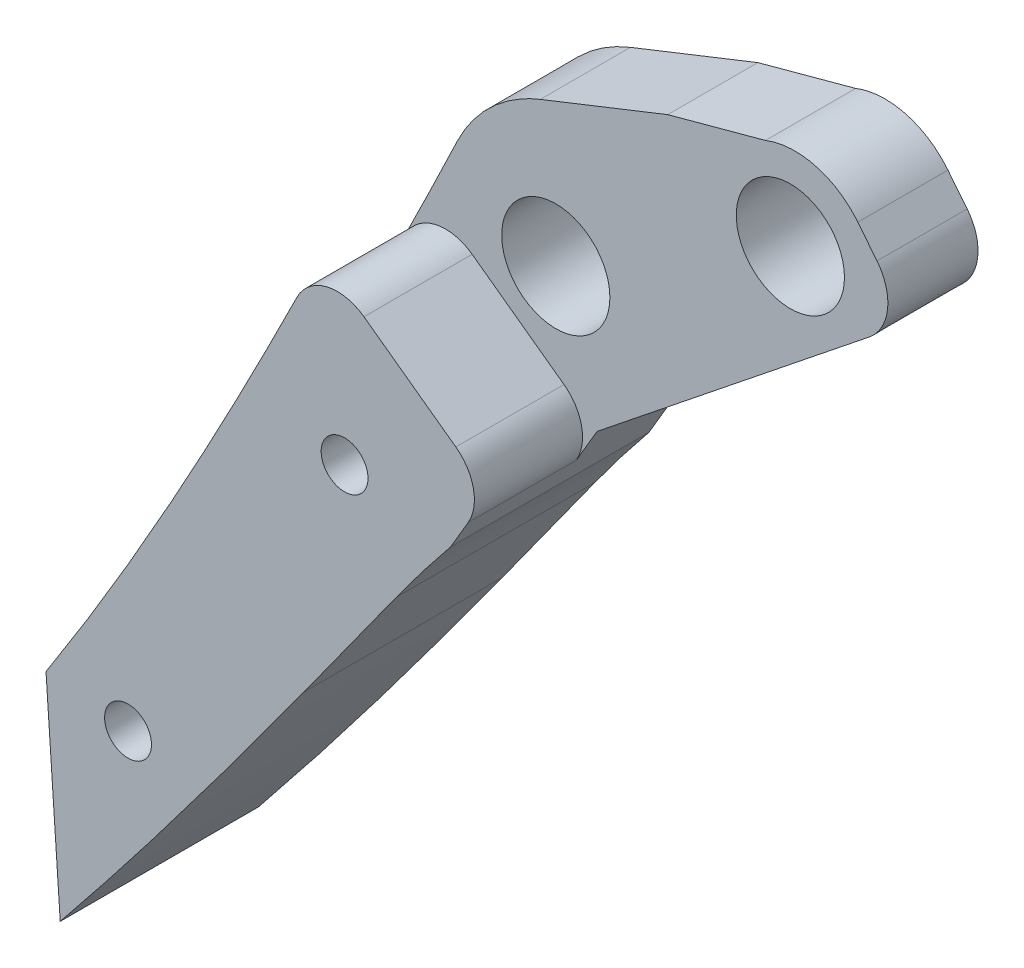
from build123d import *

# Parameters (mm, degrees)
SKETCH_1_R              = 6
SKETCH_1_R_2            = 2.6
EXTRUDE_1_DEPTH         = 22
CUT_EXTRUDE_START       = -12
CUT_EXTRUDE_1_OUTLINE_R = 6
CUT_EXTRUDE_1_DEPTH     = 12
FILLET_1_R              = 5


# Read off the part's stored shape, not the designer's step: 切除-拉伸1
with BuildPart() as part:
    # 草图1 → 凸台-拉伸1 (new body)
    with BuildSketch(Plane.XY):
        with BuildLine():
            Line((24.04705584, 21.941390991), (25.62631028, -1.269568576))
            add(Edge.make_bspline(
                [(25.62631028, -1.269568576), (30.294741582, 4.490329629), (34.848985416, 10.341994574), (43.840833171, 22.214968329), (48.277316557, 28.236694952), (52.668077763, 34.291262241)],
                knots=[0.751086715, 0.751086715, 0.751086715, 0.751086715, 0.875, 0.875, 1, 1, 1, 1], degree=3))
            add(Edge.make_bspline(
                [(52.668077763, 34.291262241), (54.385569076, 36.659627804), (56.095877797, 39.033185186), (58.65356822, 42.599078019), (59.503877121, 43.78931812), (61.206685795, 46.168192958), (62.060572053, 47.355980663), (62.923151952, 48.537325445)],
                knots=[0, 0, 0, 0, 12.867122322, 12.867122322, 19.300683483, 19.300683483, 25.734244644, 25.734244644, 25.734244644, 25.734244644], degree=3))
            add(Edge.make_bspline(
                [(62.923151952, 48.537325445), (63.691030086, 49.593267388), (64.385737457, 50.528608987), (65.152866174, 51.561457391), (65.870104463, 52.500349083), (66.644032214, 53.513449395), (67.382538536, 54.446906012), (68.169071386, 55.441067159), (68.929366855, 56.362602713)],
                knots=[0, 0, 0, 0.25, 0.25, 0.5, 0.5, 0.75, 0.75, 1, 1, 1], degree=2))
            add(Edge.make_bspline(
                [(68.929366855, 56.362602713), (68.939807825, 56.376913703), (68.94904286, 56.392240586)],
                knots=[0.088106579, 0.088106579, 0.088106579, 0.143786066, 0.143786066, 0.143786066], degree=2, weights=[1, 0.999612499, 1]))
            Line((68.94904286, 56.392240586), (73.182530774, 63.58271012))
            Line((73.182530774, 63.58271012), (77.6764923, 67.17962487))
            ThreePointArc((77.6764923, 67.17962487), (78.379967095, 67.75128437), (79.091839453, 68.312452009))
            Line((79.091839453, 68.312452009), (103.36876376, 87.743421018))
            add(Edge.make_bspline(
                [(103.36876376, 87.743421018), (103.794913212, 88.083498112), (104.14591982, 88.500209303), (104.495810247, 88.915595377), (104.757584433, 89.390611784), (105.019785316, 89.866402479), (105.18387744, 90.383514181), (105.347603834, 90.89947334), (105.407790685, 91.436682712), (105.468371762, 91.977410832), (105.422168005, 92.518813243), (105.376170251, 93.057801763), (105.226513558, 93.576866403), (105.075866476, 94.099366077), (104.826403144, 94.581721125), (104.577389608, 95.06320646), (104.239613139, 95.486702432)],
                knots=[0, 0, 0, 0.125, 0.125, 0.25, 0.25, 0.375, 0.375, 0.5, 0.5, 0.625, 0.625, 0.75, 0.75, 0.875, 0.875, 1, 1, 1], degree=2))
            Line((104.239613139, 95.486702432), (102.10787197, 98.150082549))
            add(Edge.make_bspline(
                [(102.10787197, 98.150082549), (101.662660323, 98.707408746), (101.134816221, 99.186660834), (100.605787322, 99.666988651), (100.007698858, 100.056631193), (99.413800036, 100.443544268), (98.766951597, 100.73157288), (98.115443256, 101.021676452), (97.426848492, 101.204456829), (96.741213417, 101.386451586), (96.036172435, 101.457788474), (95.327397899, 101.529503128), (94.616958411, 101.487928839), (93.907956416, 101.446438671), (93.215156177, 101.29350915), (92.520746602, 101.140224382), (91.859708878, 100.879055504)],
                knots=[0, 0, 0, 0.125, 0.125, 0.25, 0.25, 0.375, 0.375, 0.5, 0.5, 0.625, 0.625, 0.75, 0.75, 0.875, 0.875, 1, 1, 1], degree=2))
            Line((91.859708878, 100.879055504), (81.022663549, 97.937140274))
            Line((81.022663549, 97.937140274), (66.880013026, 92.33227511))
            add(Edge.make_bspline(
                [(66.880013026, 92.33227511), (65.373977149, 91.735592871), (64.00578846, 90.868278931), (62.646323986, 90.006495393), (61.470305816, 88.907497765), (60.292351586, 87.806690876), (59.339427675, 86.506195587), (58.383073515, 85.201018894), (57.686838347, 83.740417625)],
                knots=[0, 0, 0, 0.25, 0.25, 0.5, 0.5, 0.75, 0.75, 1, 1, 1], degree=2))
            add(Edge.make_bspline(
                [(57.686838347, 83.740417625), (56.095548431, 80.401632953), (54.518583687, 77.162280014)],
                knots=[0, 0, 0, 1, 1, 1], degree=2))
            add(Edge.make_bspline(
                [(54.518583687, 77.162280014), (53.763269837, 75.610969128), (52.999745837, 74.063699923), (51.467519232, 70.971710828), (50.697291265, 69.427763476), (49.146563784, 66.345016376), (48.366275895, 64.806128726), (46.794629467, 61.734063391), (46.003946156, 60.200522916), (45.205011248, 58.67121375)],
                knots=[0, 0, 0, 0, 0.25, 0.25, 0.5, 0.5, 0.75, 0.75, 1, 1, 1, 1], degree=3))
            add(Edge.make_bspline(
                [(45.205011248, 58.67121375), (41.847412181, 52.245521434), (38.381271035, 45.876195204), (31.340232317, 33.621328767), (27.77883413, 27.726649653), (24.04705584, 21.941390991)],
                knots=[0, 0, 0, 0, 0.125, 0.125, 0.243696274, 0.243696274, 0.243696274, 0.243696274], degree=3))
        make_face()
        with Locations((94.625559773, 92.089088396)):
            Circle(SKETCH_1_R, mode=Mode.SUBTRACT)
        with Locations((68.602677697, 77.162280014)):
            Circle(SKETCH_1_R, mode=Mode.SUBTRACT)
        with Locations((33.14705584, 20.777472123)):
            Circle(SKETCH_1_R_2, mode=Mode.SUBTRACT)
        with Locations((57.169835175, 58.366266824)):
            Circle(SKETCH_1_R_2, mode=Mode.SUBTRACT)
    extrude(amount=EXTRUDE_1_DEPTH)

    # 切除-拉伸1 outline → 切除-拉伸1 (cut)
    with BuildSketch(Plane.XY.offset(22).offset(CUT_EXTRUDE_START)):
        with BuildLine():
            add(Edge.make_bspline(
                [(57.686838346, 83.740417623), (56.09554843, 80.401632953), (54.518583688, 77.162280014)],
                knots=[0.494428836, 0.494428836, 0.494428836, 0.494587311, 0.494587311, 0.494587311], degree=2))
            Line((54.518583688, 77.162280014), (73.182530774, 63.58271012))
            Line((73.182530774, 63.58271012), (77.6764923, 67.17962487))
            ThreePointArc((77.6764923, 67.17962487), (78.379967095, 67.75128437), (79.091839453, 68.312452009))
            Line((79.091839453, 68.312452009), (103.36876376, 87.743421018))
            add(Edge.make_bspline(
                [(103.36876376, 87.743421018), (103.794913212, 88.083498112), (104.14591982, 88.500209303), (104.495810247, 88.915595377), (104.757584433, 89.390611784), (105.019785316, 89.866402479), (105.18387744, 90.383514181), (105.347603834, 90.89947334), (105.407790685, 91.436682712), (105.468371762, 91.977410832), (105.422168005, 92.518813243), (105.376170251, 93.057801763), (105.226513558, 93.576866403), (105.075866476, 94.099366077), (104.826403144, 94.581721125), (104.577389608, 95.06320646), (104.239613139, 95.486702432)],
                knots=[0, 0, 0, 0.125, 0.125, 0.25, 0.25, 0.375, 0.375, 0.5, 0.5, 0.625, 0.625, 0.75, 0.75, 0.875, 0.875, 1, 1, 1], degree=2))
            Line((104.239613139, 95.486702432), (102.10787197, 98.150082549))
            add(Edge.make_bspline(
                [(102.10787197, 98.150082549), (101.662660323, 98.707408746), (101.134816221, 99.186660834), (100.605787322, 99.666988651), (100.007698858, 100.056631193), (99.413800036, 100.443544268), (98.766951597, 100.73157288), (98.115443256, 101.021676452), (97.426848492, 101.204456829), (96.741213417, 101.386451586), (96.036172435, 101.457788474), (95.327397899, 101.529503128), (94.616958411, 101.487928839), (93.907956416, 101.446438671), (93.215156177, 101.29350915), (92.520746602, 101.140224382), (91.859708878, 100.879055504)],
                knots=[0, 0, 0, 0.125, 0.125, 0.25, 0.25, 0.375, 0.375, 0.5, 0.5, 0.625, 0.625, 0.75, 0.75, 0.875, 0.875, 1, 1, 1], degree=2))
            Line((91.859708878, 100.879055504), (81.022663549, 97.937140274))
            Line((81.022663549, 97.937140274), (66.880013026, 92.33227511))
            add(Edge.make_bspline(
                [(66.880013026, 92.33227511), (65.373977149, 91.735592871), (64.00578846, 90.868278931), (62.646323986, 90.006495393), (61.470305816, 88.907497765), (60.292351586, 87.806690876), (59.339427675, 86.506195587), (58.383073515, 85.201018894), (57.686838346, 83.740417623)],
                knots=[0, 0, 0, 0.25, 0.25, 0.5, 0.5, 0.75, 0.75, 1, 1, 1], degree=2))
        make_face()
        with Locations((68.602677697, 77.162280014)):
            Circle(CUT_EXTRUDE_1_OUTLINE_R, mode=Mode.SUBTRACT)
        with Locations((94.625559773, 92.089088396)):
            Circle(CUT_EXTRUDE_1_OUTLINE_R, mode=Mode.SUBTRACT)
    extrude(amount=CUT_EXTRUDE_1_DEPTH, mode=Mode.SUBTRACT)

    # 圆角1
    fillet_1_edges = [part.edges().sort_by_distance(p)[0] for p in [
        (73.182530774, 63.58271012, 16),
    ]]
    fillet(fillet_1_edges, radius=FILLET_1_R)
    # the kernel refuses this fillet: 5 mm, written as the material it takes off along each edge
    with BuildSketch(Plane(origin=(54.518583687, 77.162280014, 10), x_dir=(0.8086167393984858, -0.5883357619289866, 0), z_dir=(0, 0, 1))) as fillet_1_2_piece_1:
        with BuildLine():
            CenterArc((5.939761688, -5), FILLET_1_R, 89.999999998, 99.633547548)
            Line((1.010270575, -5.836730169), (0.911680753, -5.853464772))
            ThreePointArc((0.911680753, -5.853464772), (0.412045155, -2.934442011), (-0.098457006, -0.017499087))
            Line((-0.098457006, -0.017499087), (0, 0.1))
            Line((0, 0.1), (5.939761688, 0.1))
            Line((5.939761688, 0.1), (5.939761688, 0))
        make_face()
    extrude(amount=26.849404219, mode=Mode.SUBTRACT)


solid = part.part
